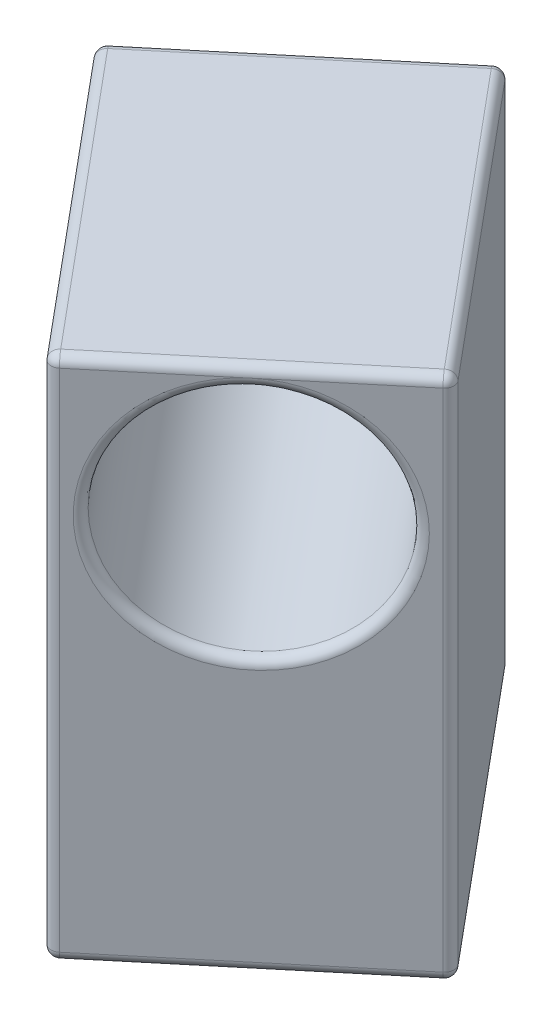
from build123d import *

# Parameters (mm, degrees)
BOSS_EXTRUDE1_DEPTH      = 7
BOSS_EXTRUDE1_DEPTH_BACK = 20
SKETCH28_R               = 6
CUT_EXTRUDE1_DEPTH       = 10
CUT_SWEEP1_PROFILE_R     = 6
FILLET1_R                = 0.5


with BuildPart() as part:
    # Sketch27 → Boss-Extrude1 (new, two sides: drawn at the far end of the back side and taken through both)
    with BuildSketch(Plane(origin=(0, 0, 0), x_dir=(1, 0, 0), z_dir=(0, 1, 0)).offset(-BOSS_EXTRUDE1_DEPTH_BACK)):
        Polygon((187.966972175, 226.25146795), (199.483711764, 235.862123975), (212.297919797, 220.506471189), (200.781180208, 210.895815164), align=None)
    extrude(amount=BOSS_EXTRUDE1_DEPTH + BOSS_EXTRUDE1_DEPTH_BACK)

    # Sketch28 → Cut-Extrude1 (cut)
    with BuildSketch(Plane.XZ.offset(20)):
        with Locations(Location((200.132445986, -223.37896957, 0), (0, 0, 270))):
            Circle(SKETCH28_R)
    extrude(amount=-CUT_EXTRUDE1_DEPTH, mode=Mode.SUBTRACT)

    # Cut-Sweep1: sweep along a path in Sketch19
    with BuildLine(Plane(origin=(0, 0, 0), x_dir=(1, 0, 0), z_dir=(0, 1, 0))) as cut_sweep1_path:
        Line((128.459886798, 309.266363493), (271.805005174, 137.491575647))
    # Cut-Sweep1 profile (on start of the path) → Cut-Sweep1 (sweep, cut)
    with BuildSketch(Plane(origin=(128.459886798, 0, -309.266363493), x_dir=(0.767782639292157, 0, -0.6407104016648784), z_dir=(0.6407104016648784, 0, 0.767782639292157))):
        Circle(CUT_SWEEP1_PROFILE_R)
    sweep(path=cut_sweep1_path.line, mode=Mode.SUBTRACT)

    # Fillet1
    fillet1_edges = [part.edges().sort_by_distance(p)[0] for p in [
        (205.890815781, 7, -228.184297582),
        (194.374076191, -20, -218.573641557),
        (193.725341969, 7, -231.056795963),
        (194.374076191, 7, -218.573641557),
        (206.539550003, 7, -215.701143177),
        (206.539550003, -20, -215.701143177),
        (200.132445986, -20, -217.37896957),
        (201.932854167, 0, -211.856880767),
        (189.118646134, 0, -227.212533553),
        (205.890815781, -20, -228.184297582),
        (212.297919797, -6.5, -220.506471189),
        (200.781180208, -6.5, -210.895815164),
        (187.966972175, -6.5, -226.25146795),
        (199.483711764, -6.5, -235.862123975),
        (193.725341969, -20, -231.056795963),
    ]]
    fillet(fillet1_edges, radius=FILLET1_R - 0.0001)  # a hair under: the kernel refuses the full size


solid = part.part
